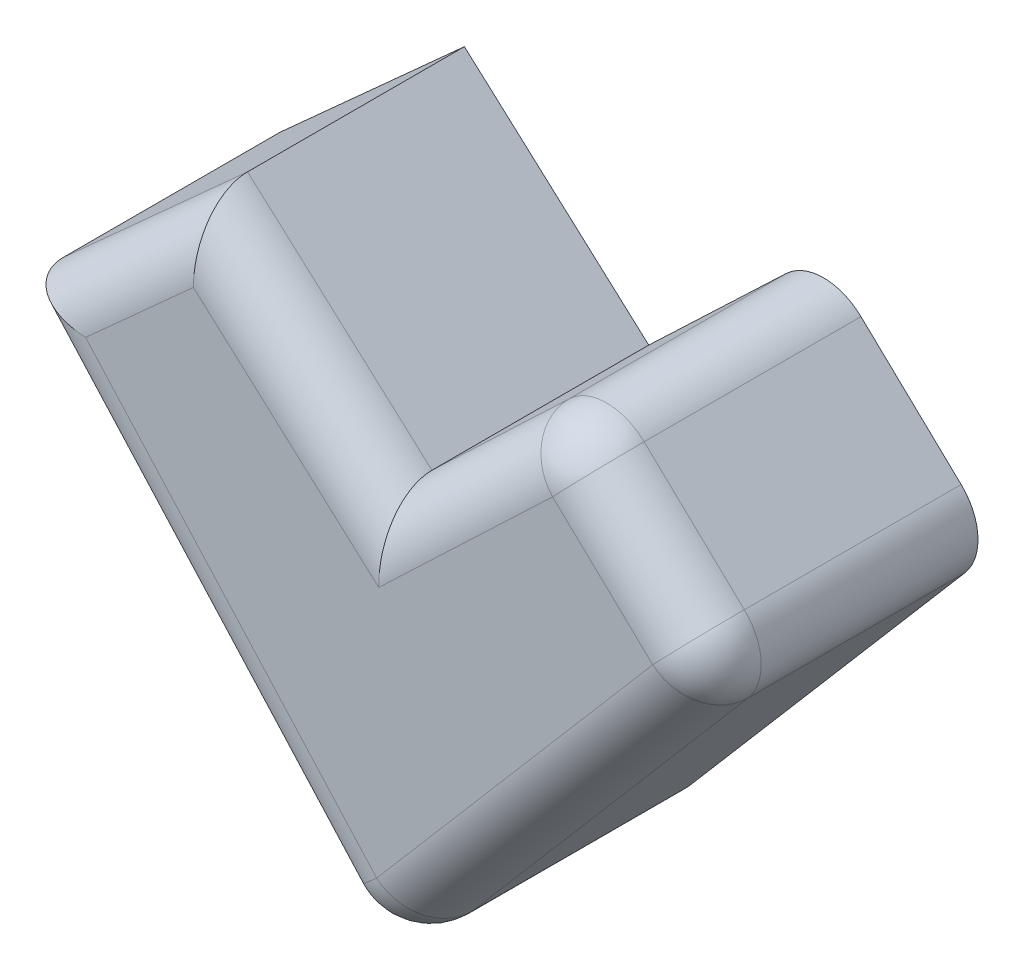
from build123d import *

# Parameters (mm, degrees)
BOSS_EXTRUDE1_DEPTH = 50
FILLET1_R           = 10


with BuildPart() as part:
    # Sketch1 → Boss-Extrude1 (new body)
    with BuildSketch(Plane.XY):
        Polygon((0, 0), (-68.020648891, 75.4139), (-34.010324446, 106.09), (0, 75.4139), (32.252675554, 106.09), (64.505351109, 75.4139), align=None)
    extrude(amount=BOSS_EXTRUDE1_DEPTH)

    # Fillet1
    fillet1_edges = [part.edges().sort_by_distance(p)[0] for p in [
        (-34.010324446, 37.70695, 50),
        (-51.015486668, 90.75195, 50),
        (-17.005162223, 90.75195, 50),
        (16.126337777, 90.75195, 50),
        (48.379013332, 90.75195, 50),
        (32.252675554, 37.70695, 50),
        (0, 0, 25),
        (64.505351109, 75.4139, 25),
        (32.252675554, 106.09, 25),
    ]]
    fillet(fillet1_edges, radius=FILLET1_R)


solid = part.part
